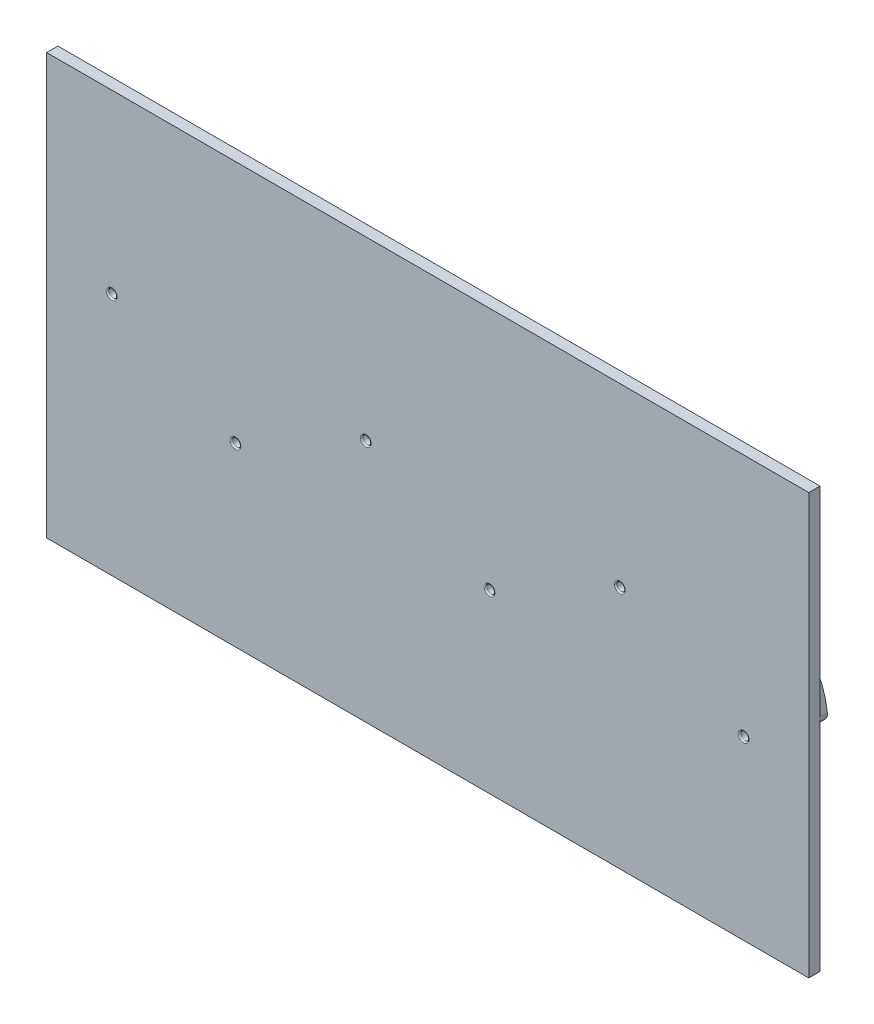
from build123d import *

# Parameters (mm, degrees)
SKETCH1_W       = 92.1
SKETCH1_H       = 50.8
EXTRUDE1_DEPTH  = 1.36
EXTRUDE2_DEPTH  = 1
FILLET1_R       = 1
SKETCH5_R       = 0.5
EXTRUDE3_DEPTH  = 96.547996316
FILLET2_R       = 1.5
FILLET3_R       = 0.17
LPATTERN3_START = -1
LPATTERN3_DEPTH = 1


# Read off the part's stored shape, not the designer's step: LPattern3
with BuildPart() as part:
    # Sketch1 → Extrude1 (new body)
    with BuildSketch(Plane.XY):
        with Locations((-46.05, 0)):
            Rectangle(SKETCH1_W, SKETCH1_H)
    extrude(amount=EXTRUDE1_DEPTH)

    # Sketch2 → Extrude2 (add)
    with BuildSketch(Plane(origin=(0, 0, 0), x_dir=(-1, 0, 0), z_dir=(0, 0, -1))):
        with BuildLine():
            Line((0.05, 0), (2, 0))
            ThreePointArc((2, 0), (4.411487502, 5.821845832), (10.233333333, 8.233333333))
            Line((10.233333333, 8.233333333), (10.233333333, 10.183333333))
            ThreePointArc((10.233333333, 10.183333333), (3.032629278, 7.200704055), (0.05, 0))
        make_face()
        with BuildLine():
            Line((15.3, 15.35), (13.35, 15.35))
            ThreePointArc((13.35, 15.35), (12.437149468, 13.146183865), (10.233333333, 12.233333333))
            Line((10.233333333, 12.233333333), (10.233333333, 10.283333333))
            ThreePointArc((10.233333333, 10.283333333), (13.816007691, 11.767325642), (15.3, 15.35))
        make_face()
        with BuildLine():
            Line((15.4, 15.35), (17.35, 15.35))
            ThreePointArc((17.35, 15.35), (21.45, 19.45), (25.55, 15.35))
            ThreePointArc((25.55, 15.35), (24.484313455, 9.992431947), (21.449494937, 5.450505063))
            Line((21.449494937, 5.450505063), (22.82835316, 4.07164684))
            ThreePointArc((22.82835316, 4.07164684), (26.285878544, 9.246199254), (27.5, 15.35))
            ThreePointArc((27.5, 15.35), (21.45, 21.4), (15.4, 15.35))
        make_face()
        with BuildLine():
            Line((7.87164684, -4.07164684), (9.250505063, -5.450505063))
            ThreePointArc((9.250505063, -5.450505063), (6.215686545, -9.992431947), (5.15, -15.35))
            ThreePointArc((5.15, -15.35), (9.25, -19.45), (13.35, -15.35))
            Line((13.35, -15.35), (15.3, -15.35))
            ThreePointArc((15.3, -15.35), (9.25, -21.4), (3.2, -15.35))
            ThreePointArc((3.2, -15.35), (4.414121456, -9.246199254), (7.87164684, -4.07164684))
        make_face()
        with BuildLine():
            Line((15.4, -15.35), (17.35, -15.35))
            ThreePointArc((17.35, -15.35), (18.262850532, -13.146183865), (20.466666667, -12.233333333))
            Line((20.466666667, -12.233333333), (20.466666667, -10.283333333))
            ThreePointArc((20.466666667, -10.283333333), (16.883992309, -11.767325642), (15.4, -15.35))
        make_face()
        with BuildLine():
            Line((20.466666667, -10.183333333), (20.466666667, -8.233333333))
            ThreePointArc((20.466666667, -8.233333333), (26.288512498, -5.821845832), (28.7, 0))
            Line((28.7, 0), (30.65, 0))
            ThreePointArc((30.65, 0), (27.667370722, -7.200704055), (20.466666667, -10.183333333))
        make_face()
    extrude(amount=EXTRUDE2_DEPTH)

    # Fillet1
    fillet1_edges = [part.edges().sort_by_distance(p)[0] for p in [
        (-10.233333333, 10.183333333, -0.5),
        (-0.05, 0, -0.5),
        (-10.233333333, 10.283333333, -0.5),
        (-15.3, 15.35, -0.5),
        (-15.4, 15.35, -0.5),
        (-20.466666667, -10.183333333, -0.5),
        (-30.65, 0, -0.5),
        (-20.466666667, -10.283333333, -0.5),
        (-15.4, -15.35, -0.5),
        (-15.3, -15.35, -0.5),
    ]]
    fillet(fillet1_edges, radius=FILLET1_R)

    # Sketch5 → Extrude3 (cut, through all)
    with BuildSketch(Plane(origin=(0, 0, 0), x_dir=(-1, 0, 0), z_dir=(0, 0, -1))):
        with Locations((22.82835316, 4.07164684)):
            Circle(SKETCH5_R)
        with Locations((7.87164684, -4.07164684)):
            Circle(SKETCH5_R)
    extrude(amount=-EXTRUDE3_DEPTH, mode=Mode.SUBTRACT)

    # Fillet2
    # the kernel refuses this fillet: 1.5 mm, written as the material it takes off along each edge
    with BuildSketch(Plane(origin=(-22.82835316, 4.07164684, 0), x_dir=(-0.6694003927494718, 0.7429018200185358, 0), z_dir=(0, 0, -1)), Plane(origin=(-7.87164684, -4.07164684, 0), x_dir=(0.6694003927494694, -0.7429018200185379, 0), z_dir=(0, 0, -1))) as fillet2_piece_1:
        with BuildLine():
            CenterArc((1.579990073, 1.497972708), FILLET2_R, 177.020803683, 95.958392635)
            Line((0.082017365, 1.575932744), (0, 0))
            ThreePointArc((0, 0), (0.828975054, -0.021556876), (1.657950109, 0))
        make_face()
    extrude(amount=5.144875272, mode=Mode.SUBTRACT)

    # Fillet3
    fillet3_edges = [part.edges().sort_by_distance(p)[0] for p in [
        (-22.32835316, 4.07164684, 1.36),
        (-22.32835316, 4.07164684, 0),
        (-7.37164684, -4.07164684, 1.36),
        (-7.37164684, -4.07164684, 0),
    ]]
    fillet(fillet3_edges, radius=FILLET3_R)

    # LPattern3 outline → LPattern3 (add)
    with BuildSketch(Plane.XY.offset(LPATTERN3_START)):
        with BuildLine():
            Line((-32.7, 0), (-31.804608827, 0))
            ThreePointArc((-31.804608827, 0), (-31.05999721, 0.332502031), (-30.810555342, 1.108892922))
            ThreePointArc((-30.810555342, 1.108892922), (-33.732629278, 7.200704055), (-39.824440411, 10.122777992))
            ThreePointArc((-39.824440411, 10.122777992), (-40.600831303, 9.873336124), (-40.933333333, 9.128724506))
            Line((-40.933333333, 9.128724506), (-40.933333333, 8.233333333))
            ThreePointArc((-40.933333333, 8.233333333), (-35.111487502, 5.821845832), (-32.7, 0))
        make_face()
        with BuildLine():
            Line((-63.4, 0), (-62.504608827, 0))
            ThreePointArc((-62.504608827, 0), (-61.75999721, 0.332502031), (-61.510555342, 1.108892922))
            ThreePointArc((-61.510555342, 1.108892922), (-64.432629278, 7.200704055), (-70.524440411, 10.122777992))
            ThreePointArc((-70.524440411, 10.122777992), (-71.300831303, 9.873336124), (-71.633333333, 9.128724506))
            Line((-71.633333333, 9.128724506), (-71.633333333, 8.233333333))
            ThreePointArc((-71.633333333, 8.233333333), (-65.811487501, 5.821845831), (-63.4, 0))
        make_face()
        with BuildLine():
            Line((-59.4, 0), (-60.295391173, 0))
            ThreePointArc((-60.295391173, 0), (-61.04000279, -0.332502031), (-61.289444658, -1.108892922))
            ThreePointArc((-61.289444658, -1.108892922), (-58.367370722, -7.200704055), (-52.275559589, -10.122777992))
            ThreePointArc((-52.275559589, -10.122777992), (-51.499168697, -9.873336124), (-51.166666667, -9.128724506))
            Line((-51.166666667, -9.128724506), (-51.166666667, -8.233333333))
            ThreePointArc((-51.166666667, -8.233333333), (-56.988512499, -5.821845831), (-59.4, 0))
        make_face()
        with BuildLine():
            Line((-90.1, 0), (-90.995391173, 0))
            ThreePointArc((-90.995391173, 0), (-91.74000279, -0.332502031), (-91.989444658, -1.108892922))
            ThreePointArc((-91.989444658, -1.108892922), (-89.067370722, -7.200704055), (-82.975559589, -10.122777992))
            ThreePointArc((-82.975559589, -10.122777992), (-82.199168697, -9.873336124), (-81.866666667, -9.128724506))
            Line((-81.866666667, -9.128724506), (-81.866666667, -8.233333333))
            ThreePointArc((-81.866666667, -8.233333333), (-87.688512499, -5.821845831), (-90.1, 0))
        make_face()
        with BuildLine():
            Line((-44.05, -15.35), (-44.9, -15.35))
            ThreePointArc((-44.9, -15.35), (-45.673957299, -15.71676221), (-45.88019802, -16.548019802))
            ThreePointArc((-45.88019802, -16.548019802), (-39.3480025, -21.369975001), (-33.9, -15.35))
            ThreePointArc((-33.9, -15.35), (-34.816802394, -10.020321799), (-37.461814386, -5.303340994))
            ThreePointArc((-37.461814386, -5.303340994), (-38.54888748, -4.750195152), (-39.687507688, -5.187507688))
            Line((-39.687507688, -5.187507688), (-39.950505063, -5.450505063))
            ThreePointArc((-39.950505063, -5.450505063), (-36.915686545, -9.992431947), (-35.85, -15.35))
            ThreePointArc((-35.85, -15.35), (-39.95, -19.45), (-44.05, -15.35))
        make_face()
        with BuildLine():
            Line((-74.75, -15.35), (-75.6, -15.35))
            ThreePointArc((-75.6, -15.35), (-76.373957299, -15.71676221), (-76.58019802, -16.548019802))
            ThreePointArc((-76.58019802, -16.548019802), (-70.0480025, -21.369975001), (-64.6, -15.35))
            ThreePointArc((-64.6, -15.35), (-65.516802394, -10.020321799), (-68.161814386, -5.303340994))
            ThreePointArc((-68.161814386, -5.303340994), (-69.24888748, -4.750195152), (-70.387507688, -5.187507688))
            Line((-70.387507688, -5.187507688), (-70.650505063, -5.450505063))
            ThreePointArc((-70.650505063, -5.450505063), (-67.615686545, -9.992431947), (-66.55, -15.35))
            ThreePointArc((-66.55, -15.35), (-70.65, -19.45), (-74.75, -15.35))
        make_face()
        with BuildLine():
            Line((-48.05, -15.35), (-47.224867867, -15.35))
            ThreePointArc((-47.224867867, -15.35), (-46.435595531, -14.964043305), (-46.25557308, -14.104098361))
            ThreePointArc((-46.25557308, -14.104098361), (-47.583992309, -11.767325642), (-49.920765027, -10.438906413))
            ThreePointArc((-49.920765027, -10.438906413), (-50.780709971, -10.618928865), (-51.166666667, -11.4082012))
            Line((-51.166666667, -11.4082012), (-51.166666667, -12.233333333))
            ThreePointArc((-51.166666667, -12.233333333), (-48.962850532, -13.146183865), (-48.05, -15.35))
        make_face()
        with BuildLine():
            Line((-78.75, -15.35), (-77.924867867, -15.35))
            ThreePointArc((-77.924867867, -15.35), (-77.135595531, -14.964043305), (-76.95557308, -14.104098361))
            ThreePointArc((-76.95557308, -14.104098361), (-78.283992309, -11.767325642), (-80.620765027, -10.438906413))
            ThreePointArc((-80.620765027, -10.438906413), (-81.480709971, -10.618928865), (-81.866666667, -11.4082012))
            Line((-81.866666667, -11.4082012), (-81.866666667, -12.233333333))
            ThreePointArc((-81.866666667, -12.233333333), (-79.662850532, -13.146183865), (-78.75, -15.35))
        make_face()
        with BuildLine():
            Line((-44.05, 15.35), (-44.875132133, 15.35))
            ThreePointArc((-44.875132133, 15.35), (-45.664404469, 14.964043305), (-45.84442692, 14.104098361))
            ThreePointArc((-45.84442692, 14.104098361), (-44.516007691, 11.767325642), (-42.179234973, 10.438906413))
            ThreePointArc((-42.179234973, 10.438906413), (-41.319290029, 10.618928865), (-40.933333333, 11.4082012))
            Line((-40.933333333, 11.4082012), (-40.933333333, 12.233333333))
            ThreePointArc((-40.933333333, 12.233333333), (-43.137149468, 13.146183865), (-44.05, 15.35))
        make_face()
        with BuildLine():
            Line((-74.75, 15.35), (-75.575132133, 15.35))
            ThreePointArc((-75.575132133, 15.35), (-76.364404469, 14.964043305), (-76.54442692, 14.104098361))
            ThreePointArc((-76.54442692, 14.104098361), (-75.216007691, 11.767325642), (-72.879234973, 10.438906413))
            ThreePointArc((-72.879234973, 10.438906413), (-72.019290029, 10.618928865), (-71.633333333, 11.4082012))
            Line((-71.633333333, 11.4082012), (-71.633333333, 12.233333333))
            ThreePointArc((-71.633333333, 12.233333333), (-73.837149468, 13.146183865), (-74.75, 15.35))
        make_face()
        with BuildLine():
            Line((-48.05, 15.35), (-47.2, 15.35))
            ThreePointArc((-47.2, 15.35), (-46.426042701, 15.71676221), (-46.21980198, 16.548019802))
            ThreePointArc((-46.21980198, 16.548019802), (-52.7519975, 21.369975001), (-58.2, 15.35))
            ThreePointArc((-58.2, 15.35), (-57.283197606, 10.020321799), (-54.638185614, 5.303340994))
            ThreePointArc((-54.638185614, 5.303340994), (-53.55111252, 4.750195152), (-52.412492312, 5.187507688))
            Line((-52.412492312, 5.187507688), (-52.149494937, 5.450505063))
            ThreePointArc((-52.149494937, 5.450505063), (-55.184313455, 9.992431947), (-56.25, 15.35))
            ThreePointArc((-56.25, 15.35), (-52.15, 19.45), (-48.05, 15.35))
        make_face()
        with BuildLine():
            Line((-78.75, 15.35), (-77.9, 15.35))
            ThreePointArc((-77.9, 15.35), (-77.126042701, 15.71676221), (-76.91980198, 16.548019802))
            ThreePointArc((-76.91980198, 16.548019802), (-83.4519975, 21.369975001), (-88.9, 15.35))
            ThreePointArc((-88.9, 15.35), (-87.983197606, 10.020321799), (-85.338185614, 5.303340994))
            ThreePointArc((-85.338185614, 5.303340994), (-84.25111252, 4.750195152), (-83.112492312, 5.187507688))
            Line((-83.112492312, 5.187507688), (-82.849494937, 5.450505063))
            ThreePointArc((-82.849494937, 5.450505063), (-85.884313455, 9.992431947), (-86.95, 15.35))
            ThreePointArc((-86.95, 15.35), (-82.85, 19.45), (-78.75, 15.35))
        make_face()
    extrude(amount=LPATTERN3_DEPTH)

    # LPattern3 2 outline → LPattern3 2 (revolve, cut)
    with BuildSketch(Plane(origin=(-53.52835316, 4.07164684, 0), x_dir=(1, 0, 0), z_dir=(0, -1, 0))):
        with BuildLine():
            ThreePointArc((0.5, 1.19), (0.549791847, 1.310208153), (0.67, 1.36))
            Line((0.67, 1.36), (0, 1.36))
            Line((0, 1.36), (0, 0))
            Line((0, 0), (0.67, 0))
            ThreePointArc((0.67, 0), (0.549791847, 0.049791847), (0.5, 0.17))
            Line((0.5, 0.17), (0.5, 1.19))
        make_face()
    revolve(axis=Axis((-53.52835316, 4.07164684, 0), (0, 0, 1)), mode=Mode.SUBTRACT)

    # LPattern3 3 outline → LPattern3 3 (revolve, cut)
    with BuildSketch(Plane(origin=(-84.22835316, 4.07164684, 0), x_dir=(1, 0, 0), z_dir=(0, -1, 0))):
        with BuildLine():
            Line((0, 0), (0.67, 0))
            ThreePointArc((0.67, 0), (0.549791847, 0.049791847), (0.5, 0.17))
            Line((0.5, 0.17), (0.5, 1.19))
            ThreePointArc((0.5, 1.19), (0.549791847, 1.310208153), (0.67, 1.36))
            Line((0.67, 1.36), (0, 1.36))
            Line((0, 1.36), (0, 0))
        make_face()
    revolve(axis=Axis((-84.22835316, 4.07164684, 0), (0, 0, 1)), mode=Mode.SUBTRACT)

    # LPattern3 4 outline → LPattern3 4 (revolve, cut)
    with BuildSketch(Plane(origin=(-38.57164684, -4.07164684, 0), x_dir=(1, 0, 0), z_dir=(0, -1, 0))):
        with BuildLine():
            ThreePointArc((0.5, 1.19), (0.549791847, 1.310208153), (0.67, 1.36))
            Line((0.67, 1.36), (0, 1.36))
            Line((0, 1.36), (0, 0))
            Line((0, 0), (0.67, 0))
            ThreePointArc((0.67, 0), (0.549791847, 0.049791847), (0.5, 0.17))
            Line((0.5, 0.17), (0.5, 1.19))
        make_face()
    revolve(axis=Axis((-38.57164684, -4.07164684, 0), (0, 0, 1)), mode=Mode.SUBTRACT)

    # LPattern3 5 outline → LPattern3 5 (revolve, cut)
    with BuildSketch(Plane(origin=(-69.27164684, -4.07164684, 0), x_dir=(1, 0, 0), z_dir=(0, -1, 0))):
        with BuildLine():
            Line((0, 0), (0.67, 0))
            ThreePointArc((0.67, 0), (0.549791847, 0.049791847), (0.5, 0.17))
            Line((0.5, 0.17), (0.5, 1.19))
            ThreePointArc((0.5, 1.19), (0.549791847, 1.310208153), (0.67, 1.36))
            Line((0.67, 1.36), (0, 1.36))
            Line((0, 1.36), (0, 0))
        make_face()
    revolve(axis=Axis((-69.27164684, -4.07164684, 0), (0, 0, 1)), mode=Mode.SUBTRACT)


solid = part.part
